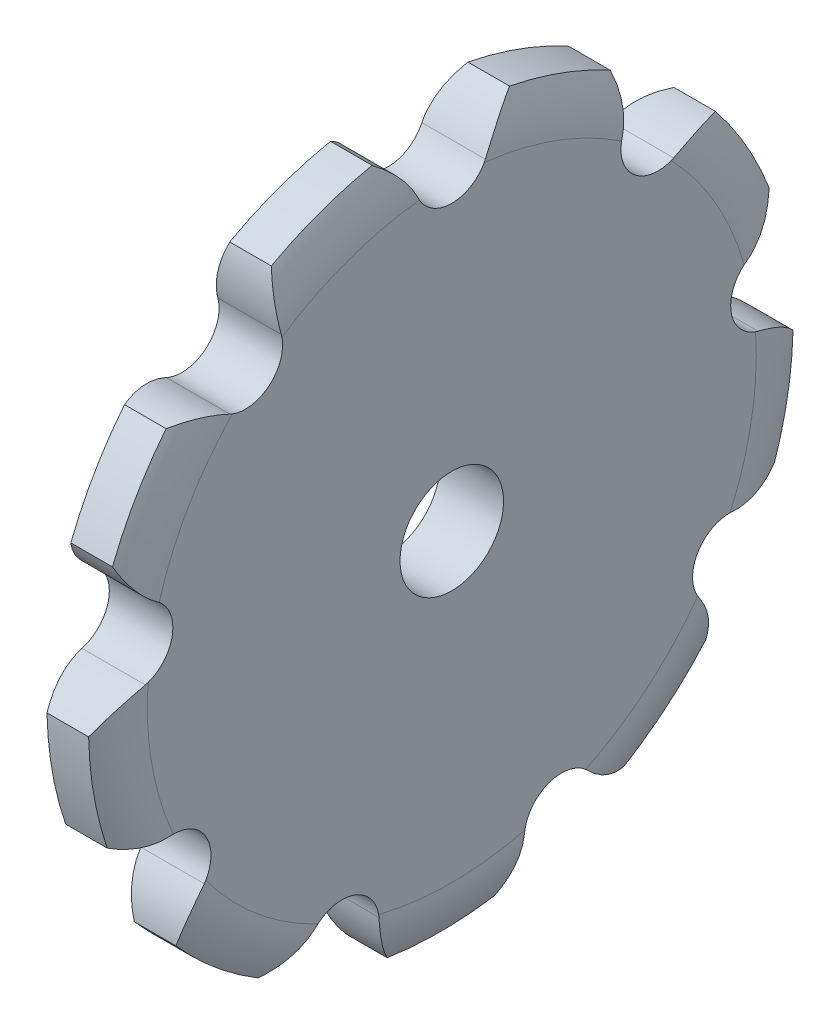
from build123d import *

# Parameters (mm, degrees)
TOOTHCUT_DEPTH  = 59.188528112
TEETHCUTS_COUNT = 9
TEETHCUTS_ANGLE = 320
BORSKE_R        = 6
BORE_DEPTH      = 10.363


with BuildPart() as part:
    # BasProSke → Base-Revolve (revolve)
    with BuildSketch(Plane(origin=(0, 0, 0), x_dir=(1, 0, 0), z_dir=(0, 1, 0))):
        with BuildLine():
            Line((0, 0), (0, 35.279014264))
            ThreePointArc((0, 35.279014264), (0.321571182, 38.118820596), (1.27, 40.814815923))
            Line((1.27, 40.814815923), (6.0925, 40.814815923))
            ThreePointArc((6.0925, 40.814815923), (7.040928818, 38.118820596), (7.3625, 35.279014264))
            Line((7.3625, 35.279014264), (7.3625, 0))
            Line((7.3625, 0), (0, 0))
        make_face()
    revolve(axis=Axis((-10, 0, 0), (1, 0, 0)))

    # TooCutSke → ToothCut (cut, through all)
    with BuildSketch(Plane(origin=(0, 0, 0), x_dir=(0, 0, -1), z_dir=(1, 0, 0))):
        with BuildLine():
            ThreePointArc((3.89490303, 35.358642812), (5.602226943, 37.985977795), (7.968827222, 40.039522822))
            ThreePointArc((7.968827222, 40.039522822), (0, 40.824815923), (-7.968827222, 40.039522822))
            ThreePointArc((-7.968827222, 40.039522822), (-5.602226943, 37.985977795), (-3.89490303, 35.358642812))
            ThreePointArc((-3.89490303, 35.358642812), (0, 32.877315923), (3.89490303, 35.358642812))
        make_face()
    toothcut = extrude(amount=TOOTHCUT_DEPTH, mode=Mode.SUBTRACT)

    # TeethCuts: ToothCut ×9 about axis
    teethcuts_axis = Axis((-10, 0, 0), (1, 0, 0))
    for i in range(1, TEETHCUTS_COUNT):
        add(toothcut.rotate(teethcuts_axis, i * TEETHCUTS_ANGLE / (TEETHCUTS_COUNT - 1)), mode=Mode.SUBTRACT)

    # BorSke → Bore (cut, symmetric)
    with BuildSketch(Plane(origin=(0, 0, 0), x_dir=(0, 0, -1), z_dir=(1, 0, 0))):
        Circle(BORSKE_R)
    extrude(amount=BORE_DEPTH, both=True, mode=Mode.SUBTRACT)


solid = part.part
